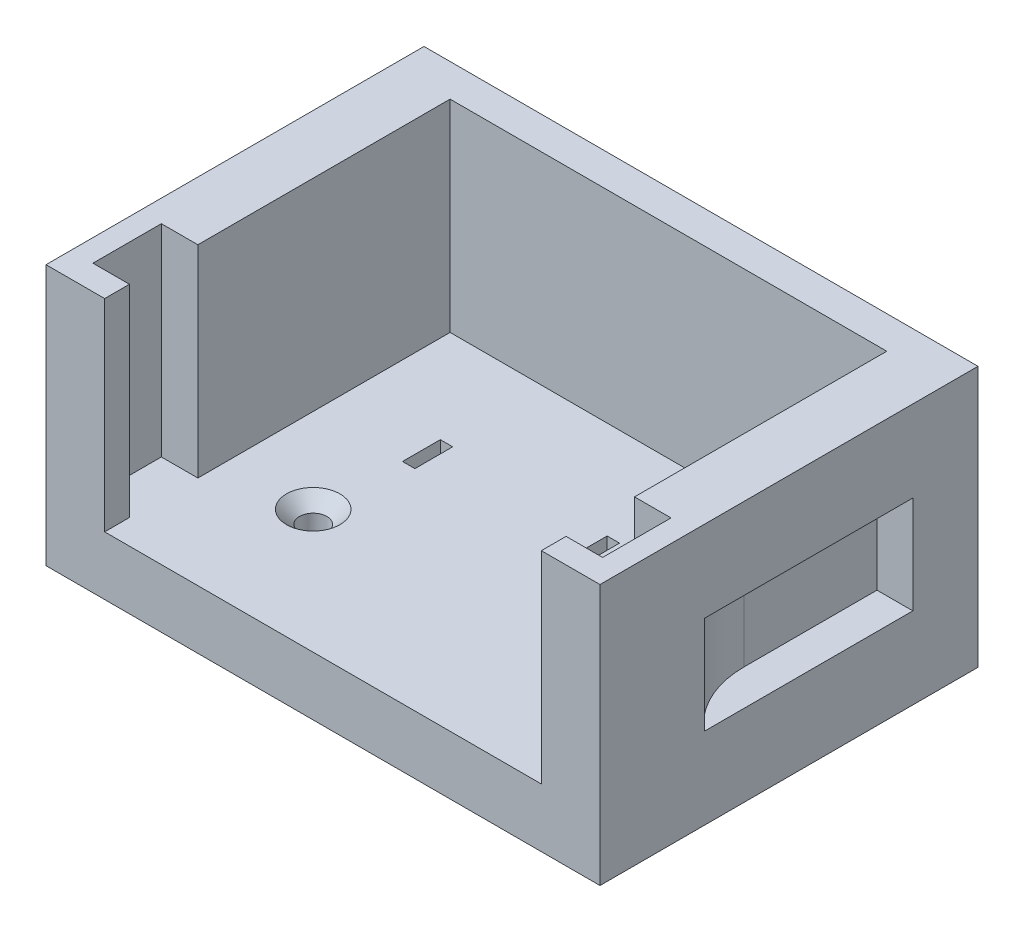
from build123d import *

# Parameters (mm, degrees)
SKETCH1_W                                         = 91
SKETCH1_H                                         = 70
BOSS_EXTRUDE1_DEPTH                               = 9
BOSS_EXTRUDE2_DEPTH                               = 31
SKETCH3_W                                         = 5.6
SKETCH3_H                                         = 10.5
CUT_EXTRUDE1_DEPTH                                = 31
SKETCH4_W                                         = 4.7
SKETCH4_H                                         = 4.9
BOSS_EXTRUDE3_DEPTH                               = 18.5
FILLET1_R                                         = 2
SKETCH5_W                                         = 1.9
SKETCH5_H                                         = 5.8
CUT_EXTRUDE2_DEPTH                                = 19
CSK_FOR_M3_5_FLAT_HEAD_MACHINE_SCREW1_D           = 4.2
CSK_FOR_M3_5_FLAT_HEAD_MACHINE_SCREW1_CSINK_D     = 8.2
CSK_FOR_M3_5_FLAT_HEAD_MACHINE_SCREW1_CSINK_ANGLE = 90
SKETCH11_W                                        = 101.27142764
SKETCH11_H                                        = 82.667879483
SKETCH11_W_2                                      = 85
SKETCH11_H_2                                      = 73.983129472
CUT_EXTRUDE4_DEPTH                                = 49
SKETCH12_W                                        = 32
SKETCH12_H                                        = 15
CUT_EXTRUDE5_DEPTH                                = 5.5
FILLET3_R                                         = 15
FILLET3_OF_MIRROR1_R                              = 15
SKETCH13_W                                        = 85
SKETCH13_H                                        = 10
CUT_EXTRUDE6_DEPTH                                = 53
SKETCH14_W                                        = 23
SKETCH14_H                                        = 31
CUT_EXTRUDE7_DEPTH                                = 10


with BuildPart() as part:
    # Sketch1 → Boss-Extrude1 (new body)
    with BuildSketch(Plane(origin=(0, 0, 0), x_dir=(1, 0, 0), z_dir=(0, 1, 0))):
        Rectangle(SKETCH1_W, SKETCH1_H)
    extrude(amount=BOSS_EXTRUDE1_DEPTH)

    # Sketch2 → Boss-Extrude2 (add)
    with BuildSketch(Plane(origin=(0, 9, 0), x_dir=(1, 0, 0), z_dir=(0, 1, 0))):
        Polygon((-33.5, -35), (-33.5, 28), (33.5, 28), (33.5, -35), (45.5, -35), (45.5, 35), (-45.5, 35), (-45.5, -35), align=None)
    extrude(amount=BOSS_EXTRUDE2_DEPTH)

    # Sketch3 → Cut-Extrude1 (cut)
    with BuildSketch(Plane(origin=(0, 40, 0), x_dir=(1, 0, 0), z_dir=(0, 1, 0))):
        with Locations((-36.3, -15.95)):
            Rectangle(SKETCH3_W, SKETCH3_H)
        with Locations((36.3, -15.95)):
            Rectangle(SKETCH3_W, SKETCH3_H)
    extrude(amount=-CUT_EXTRUDE1_DEPTH, mode=Mode.SUBTRACT)

    # Sketch4 → Boss-Extrude3 (add)
    with BuildSketch(Plane(origin=(0, 9, 0), x_dir=(1, 0, 0), z_dir=(0, 1, 0))):
        with Locations((-7.15, 25.55)):
            Rectangle(SKETCH4_W, SKETCH4_H)
        with Locations((7.15, 25.55)):
            Rectangle(SKETCH4_W, SKETCH4_H)
    extrude(amount=BOSS_EXTRUDE3_DEPTH)

    # Fillet1
    fillet1_edges = [part.edges().sort_by_distance(p)[0] for p in [
        (-9.5, 27.5, -25.55),
        (-4.8, 27.5, -25.55),
        (4.8, 27.5, -25.55),
        (9.5, 27.5, -25.55),
    ]]
    fillet(fillet1_edges, radius=FILLET1_R)

    # Sketch5 → Cut-Extrude2 (cut)
    with BuildSketch(Plane(origin=(0, 9, 0), x_dir=(1, 0, 0), z_dir=(0, 1, 0))):
        with Locations((-19.05, 10.1)):
            Rectangle(SKETCH5_W, SKETCH5_H)
        with Locations((6.55, 10.1)):
            Rectangle(SKETCH5_W, SKETCH5_H)
    extrude(amount=-CUT_EXTRUDE2_DEPTH, mode=Mode.SUBTRACT)

    # CSK for M3.5 Flat Head Machine Screw1 (through all)
    with Locations(Plane(origin=(-20.5, 9, 6), x_dir=(0, 0, 1), z_dir=(0, 1, 0))):
        with Locations((0, 0), (0, 41)):
            CounterSinkHole(CSK_FOR_M3_5_FLAT_HEAD_MACHINE_SCREW1_D / 2, CSK_FOR_M3_5_FLAT_HEAD_MACHINE_SCREW1_CSINK_D / 2, counter_sink_angle=CSK_FOR_M3_5_FLAT_HEAD_MACHINE_SCREW1_CSINK_ANGLE)

    # Sketch11 → Cut-Extrude4 (cut)
    with BuildSketch(Plane(origin=(0, 40, 0), x_dir=(1, 0, 0), z_dir=(0, 1, 0))):
        with Locations((-0.171320914, -3.126256715)):
            Rectangle(SKETCH11_W, SKETCH11_H)
        with Locations((0, -3.991564736)):
            Rectangle(SKETCH11_W_2, SKETCH11_H_2, mode=Mode.SUBTRACT)
    extrude(amount=-CUT_EXTRUDE4_DEPTH, mode=Mode.SUBTRACT)

    # Sketch12 → Cut-Extrude5 (cut)
    with BuildSketch(Plane.ZY.offset(42.5)):
        with Locations((-7, 20)):
            Rectangle(SKETCH12_W, SKETCH12_H)
    cut_extrude5 = extrude(amount=-CUT_EXTRUDE5_DEPTH, mode=Mode.SUBTRACT)

    # Fillet3
    # the kernel refuses this fillet: 15 mm, written as the material it adds along each edge
    with BuildSketch(Plane(origin=(-37, 27.5, 9), x_dir=(-1, 0, 0), z_dir=(0, -1, 0))) as fillet3_piece_1:
        with BuildLine():
            CenterArc((15, 11.608186766), FILLET3_R, 180, 50.703519761)
            Line((0, 11.608186766), (-0.3, 11.608186766))
            Line((-0.3, 11.608186766), (-0.3, 0))
            Line((-0.3, 0), (0, -0.3))
            ThreePointArc((0, -0.3), (2.75, -0.3), (5.31, -0.232163735))
            Line((5.31, -0.232163735), (5.5, 0))
        make_face()
    extrude(amount=15)

    # Mirror1: Cut-Extrude5 across plane
    add(cut_extrude5.mirror(Plane(origin=(0, 0, 0), x_dir=(0, 0, 1), z_dir=(1, 0, 0))), mode=Mode.SUBTRACT)

    # Fillet3 of Mirror1
    # the kernel refuses this fillet: 15 mm, written as the material it adds along each edge
    with BuildSketch(Plane(origin=(37, 27.5, 9), x_dir=(1, 0, 0), z_dir=(0, -1, 0))) as fillet3_of_mirror1_piece_1:
        with BuildLine():
            CenterArc((15, -11.608186766), FILLET3_OF_MIRROR1_R, 129.296480239, 50.703519761)
            Line((0, -11.608186766), (-0.3, -11.608186766))
            Line((-0.3, -11.608186766), (-0.3, 0))
            Line((-0.3, 0), (0, 0.3))
            ThreePointArc((0, 0.3), (2.75, 0.3), (5.31, 0.232163735))
            Line((5.31, 0.232163735), (5.5, 0))
        make_face()
    extrude(amount=15)

    # Sketch13 → Cut-Extrude6 (cut)
    with BuildSketch(Plane(origin=(0, 40, 0), x_dir=(1, 0, 0), z_dir=(0, 1, 0))):
        with Locations((0, -30)):
            Rectangle(SKETCH13_W, SKETCH13_H)
    extrude(amount=-CUT_EXTRUDE6_DEPTH, mode=Mode.SUBTRACT)

    # Sketch14 → Cut-Extrude7 (cut)
    with BuildSketch(Plane.XY.offset(-28)):
        with Locations((-1.5, 24.5)):
            Rectangle(SKETCH14_W, SKETCH14_H)
    extrude(amount=CUT_EXTRUDE7_DEPTH, mode=Mode.SUBTRACT)


solid = part.part
